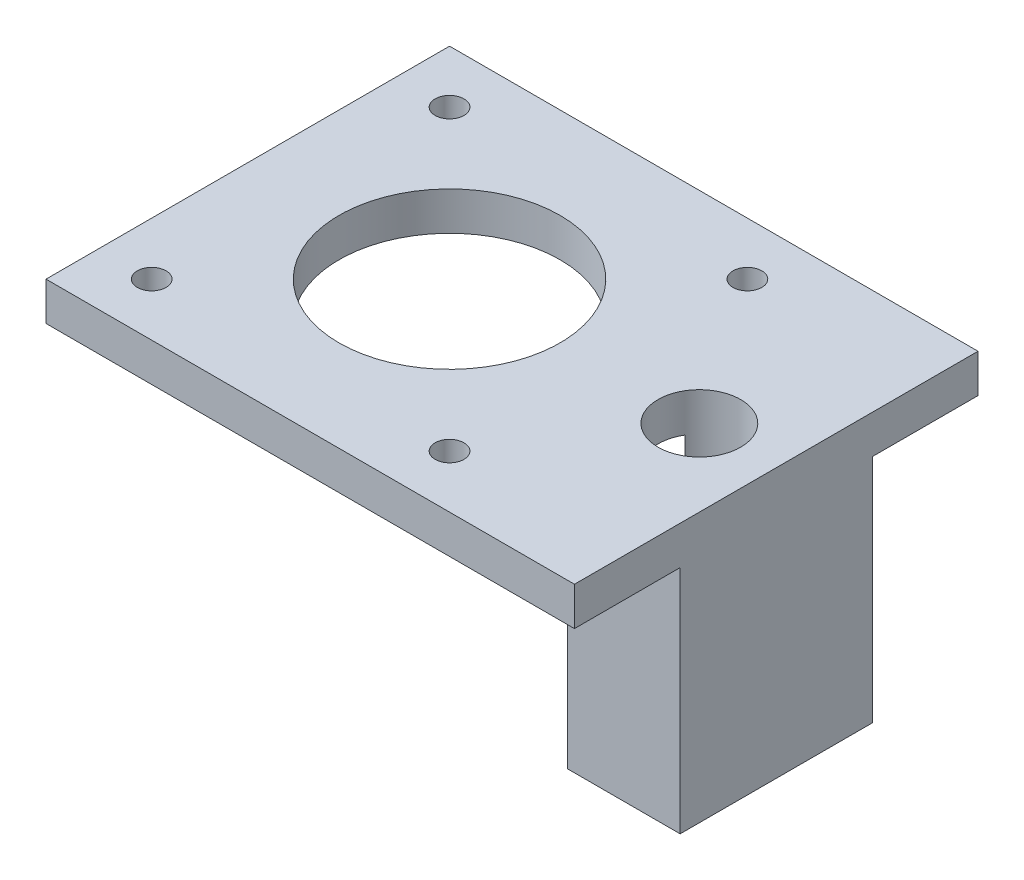
from build123d import *

# Parameters (mm, degrees)
SKETCH1_W           = 55
SKETCH1_H           = 42
SKETCH1_R           = 4.3
SKETCH1_R_2         = 11.5
SKETCH1_R_3         = 1.5
BOSS_EXTRUDE1_DEPTH = 4
BOSS_EXTRUDE2_START = 20
BOSS_EXTRUDE2_DEPTH = 20
SKETCH3_W           = 11.7
SKETCH3_H           = 20
BOSS_EXTRUDE3_DEPTH = 4


with BuildPart() as part:
    # Sketch1 → Boss-Extrude1 (new body)
    with BuildSketch(Plane(origin=(0, 0, 0), x_dir=(1, 0, 0), z_dir=(0, 1, 0))):
        with Locations((27.5, 21)):
            Rectangle(SKETCH1_W, SKETCH1_H)
        with Locations((47, 21)):
            Circle(SKETCH1_R, mode=Mode.SUBTRACT)
        with Locations((21, 21)):
            Circle(SKETCH1_R_2, mode=Mode.SUBTRACT)
        with Locations((5.5, 36.5)):
            Circle(SKETCH1_R_3, mode=Mode.SUBTRACT)
        with Locations((36.5, 36.5)):
            Circle(SKETCH1_R_3, mode=Mode.SUBTRACT)
        with Locations((5.5, 5.5)):
            Circle(SKETCH1_R_3, mode=Mode.SUBTRACT)
        with Locations((36.5, 5.5)):
            Circle(SKETCH1_R_3, mode=Mode.SUBTRACT)
    extrude(amount=BOSS_EXTRUDE1_DEPTH)

    # Sketch2 → Boss-Extrude2 (add)
    with BuildSketch(Plane.XZ.offset(BOSS_EXTRUDE2_START)):
        with BuildLine():
            Line((55, -11), (43.3, -11))
            Line((43.3, -11), (43.3, -18.80910977))
            ThreePointArc((43.3, -18.80910977), (51.3, -21), (43.3, -23.19089023))
            Line((43.3, -23.19089023), (43.3, -31))
            Line((43.3, -31), (55, -31))
            Line((55, -31), (55, -11))
        make_face()
    extrude(amount=-BOSS_EXTRUDE2_DEPTH)

    # Sketch3 → Boss-Extrude3 (add)
    with BuildSketch(Plane.XZ.offset(20)):
        with Locations((49.15, -21)):
            Rectangle(SKETCH3_W, SKETCH3_H)
    extrude(amount=BOSS_EXTRUDE3_DEPTH)


solid = part.part
